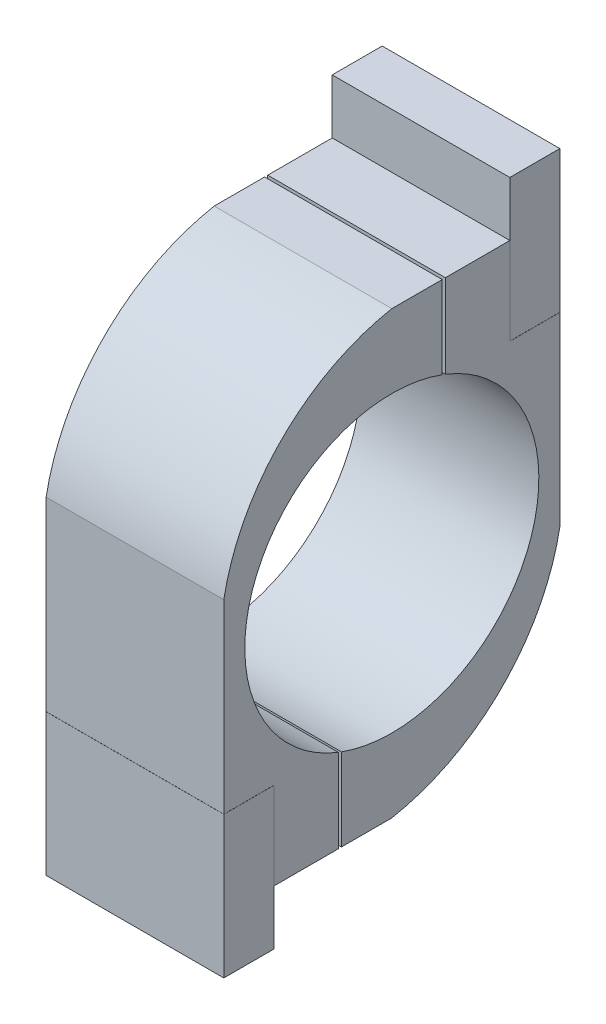
from build123d import *

# Parameters (mm, degrees)
BOSS_EXTRUDE1_DEPTH = 8.4582
BOSS_EXTRUDE2_DEPTH = 8.4582
BOSS_EXTRUDE3_DEPTH = 8.4582
BOSS_EXTRUDE4_DEPTH = 8.4582


with BuildPart() as part:
    # Sketch2 → Boss-Extrude1 (new, symmetric)
    with BuildSketch(Plane(origin=(0, 0, 0), x_dir=(0, 0, -1), z_dir=(1, 0, 0))):
        with BuildLine():
            Line((11.2375, 12.626420089), (11.2375, 20.926598663))
            Line((11.2375, 20.926598663), (5.1, 20.926598663))
            Line((5.1, 20.926598663), (5.1, 12.964619985))
            ThreePointArc((5.1, 12.964619985), (13.757403434, -2.668367762), (0, -14.073401337))
            ThreePointArc((0, -14.073401337), (-2.437215533, -13.859625637), (-4.8, -13.224827115))
            Line((-4.8, -13.224827115), (-4.8, -21.073401337))
            Line((-4.8, -21.073401337), (0, -21.073401337))
            ThreePointArc((0, -21.073401337), (10.480231834, -15.553633171), (16, -5.073401337))
            Line((16, -5.073401337), (16, 12.616598663))
            Line((16, 12.616598663), (11.2375, 12.616598663))
            Line((11.2375, 12.616598663), (11.2375, 12.626420089))
        make_face()
    extrude(amount=BOSS_EXTRUDE1_DEPTH, both=True)


with BuildPart() as body_2:
    # Sketch2<4> → Boss-Extrude2 (new, symmetric)
    with BuildSketch(Plane(origin=(0, 0, 0), x_dir=(0, 0, -1), z_dir=(1, 0, 0))):
        with BuildLine():
            Line((-11.2375, -12.773222763), (-11.2375, -21.073401337))
            Line((-11.2375, -21.073401337), (-5.1, -21.073401337))
            Line((-5.1, -21.073401337), (-5.1, -13.111422659))
            ThreePointArc((-5.1, -13.111422659), (-13.757403434, 2.521565087), (0, 13.926598663))
            ThreePointArc((0, 13.926598663), (2.437215533, 13.712822963), (4.8, 13.078024441))
            Line((4.8, 13.078024441), (4.8, 20.926598663))
            Line((4.8, 20.926598663), (0, 20.926598663))
            ThreePointArc((0, 20.926598663), (-10.480231834, 15.406830497), (-16, 4.926598663))
            Line((-16, 4.926598663), (-16, -12.763401337))
            Line((-16, -12.763401337), (-11.2375, -12.763401337))
            Line((-11.2375, -12.763401337), (-11.2375, -12.773222763))
        make_face()
    extrude(amount=BOSS_EXTRUDE2_DEPTH, both=True)


with BuildPart() as body_3:
    # Sketch2<5> → Boss-Extrude3 (new, symmetric)
    with BuildSketch(Plane(origin=(0, 0, 0), x_dir=(0, 0, -1), z_dir=(1, 0, 0))):
        Polygon((16, 26.126420089), (11.2375, 26.126420089), (11.2375, 20.926598663), (11.2375, 12.626420089), (16, 12.626420089), align=None)
    extrude(amount=BOSS_EXTRUDE3_DEPTH, both=True)


with BuildPart() as body_4:
    # Sketch2<6> → Boss-Extrude4 (new, symmetric)
    with BuildSketch(Plane(origin=(0, 0, 0), x_dir=(0, 0, -1), z_dir=(1, 0, 0))):
        Polygon((-16, -26.273222763), (-11.2375, -26.273222763), (-11.2375, -21.073401337), (-11.2375, -12.773222763), (-16, -12.773222763), align=None)
    extrude(amount=BOSS_EXTRUDE4_DEPTH, both=True)


solid = Compound([part.part, body_2.part, body_3.part, body_4.part])
